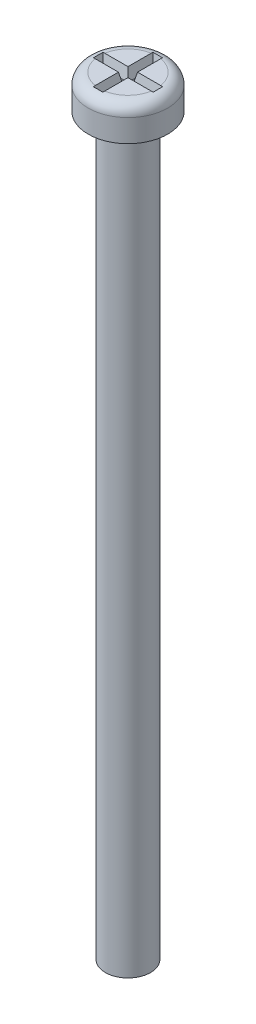
from build123d import *

# Parameters (mm, degrees)
SKETCH_1_R          = 2
EXTRUDE_1_DEPTH     = 65
SKETCH_2_R          = 3.515
EXTRUDE_2_DEPTH     = 3
CUT_EXTRUDE_1_DEPTH = 1
CUT_EXTRUDE_1_DRAFT = -12
FILLET_2_R          = 1


with BuildPart() as part:
    # Эскиз1 → Бобышка-Вытянуть1 (new body)
    with BuildSketch(Plane(origin=(0, 0, 0), x_dir=(1, 0, 0), z_dir=(0, 1, 0))):
        with Locations(Location((0, 0, 0), (0, 0, 270))):
            Circle(SKETCH_1_R)
    extrude(amount=EXTRUDE_1_DEPTH)

    # Эскиз2 → Бобышка-Вытянуть2 (add)
    with BuildSketch(Plane(origin=(0, 65, 0), x_dir=(1, 0, 0), z_dir=(0, 1, 0))):
        with Locations(Location((0, 0, 0), (0, 0, 270))):
            Circle(SKETCH_2_R)
    extrude(amount=EXTRUDE_2_DEPTH)


with BuildPart() as cut_extrude_1_tool:
    # Эскиз3 → Вырез-Вытянуть1 (with draft: the straight prism first)
    with BuildSketch(Plane(origin=(0, 68, 0), x_dir=(1, 0, 0), z_dir=(0, 1, 0))):
        Polygon((-2.641549473, 0.422769916), (-2.641549473, -0.422769916), (-0.422769916, -0.422769916), (-0.422769916, -2.641549473), (0.422769916, -2.641549473), (0.422769916, -0.422769916), (2.641549473, -0.422769916), (2.641549473, 0.422769916), (0.422769916, 0.422769916), (0.422769916, 2.641549473), (-0.422769916, 2.641549473), (-0.422769916, 0.422769916), align=None)
    extrude(amount=-CUT_EXTRUDE_1_DEPTH)
    # Вырез-Вытянуть1: the draft: its side faces are tilted about the plane it starts from
    cut_extrude_1_sides = [cut_extrude_1_tool.faces().sort_by_distance(p)[0] for p in [
        (-2.641549473, 67.5, 0),
        (-1.532159694, 67.5, 0.422769916),
        (-0.422769916, 67.5, 1.532159694),
        (0, 67.5, 2.641549473),
        (0.422769916, 67.5, 1.532159694),
        (1.532159694, 67.5, 0.422769916),
        (2.641549473, 67.5, 0),
        (1.532159694, 67.5, -0.422769916),
        (0.422769916, 67.5, -1.532159694),
        (0, 67.5, -2.641549473),
        (-0.422769916, 67.5, -1.532159694),
        (-1.532159694, 67.5, -0.422769916),
    ]]
    draft(cut_extrude_1_sides, Plane(origin=(0, 68, 0), x_dir=(1, 0, 0), z_dir=(0, 1, 0)), CUT_EXTRUDE_1_DRAFT)


with BuildPart() as part_1:
    add(part.part)

    # Вырез-Вытянуть1: cut by cut_extrude_1_tool
    add(cut_extrude_1_tool.part, mode=Mode.SUBTRACT)

    # Скругление2
    # the kernel refuses this fillet: 1 mm, written as the material it takes off along each edge
    with BuildSketch(Plane(origin=(0, 68, 0), x_dir=(0, 0, 1), z_dir=(-1, 0, 0))) as fillet_2_piece_1:
        with BuildLine():
            CenterArc((3.515 - FILLET_2_R, -FILLET_2_R), FILLET_2_R, 0, 90)
            Line((3.515 - FILLET_2_R, 0), (3.515, 0))
            Line((3.515, 0), (3.515, -FILLET_2_R))
        make_face()
    revolve(axis=Axis((0, 68, 0), (0, 1, 0)), mode=Mode.SUBTRACT)


solid = part_1.part
